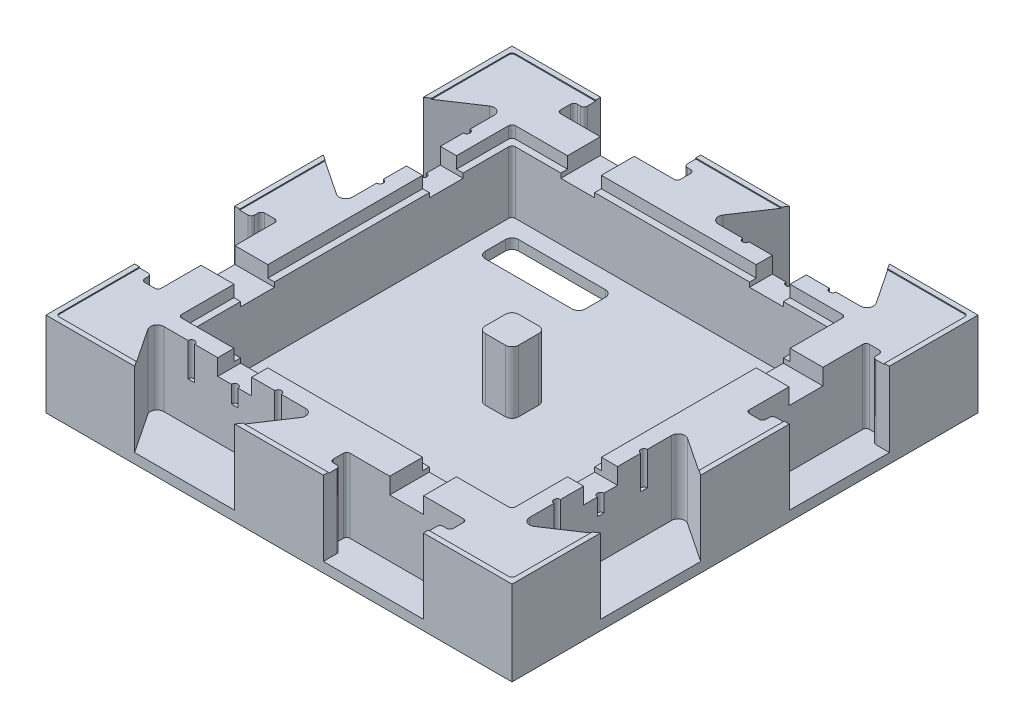
from build123d import *

# Parameters (mm, degrees)
SKETCH1_W           = 139.7
SKETCH1_H           = 139.7
BOSS_EXTRUDE1_DEPTH = 12.7
SKETCH2_W           = 136.7
SKETCH2_H           = 136.7
CUT_EXTRUDE1_DEPTH  = 0.3
CUT_EXTRUDE2_START  = -22.4
CUT_EXTRUDE2_DEPTH  = 125.396102867
CUT_EXTRUDE4_DEPTH  = 10
FILLET1_R           = 1
FILLET3_R           = 2
CIRPATTERN1_START   = -9.7
CIRPATTERN1_DEPTH   = 22.4
CIRPATTERN1_START_2 = 2.4
CIRPATTERN1_2_DEPTH = 10
SKETCH13_W          = 100
SKETCH13_H          = 100
CUT_EXTRUDE5_DEPTH  = 22.1
SKETCH14_W          = 100
SKETCH14_H          = 100
SKETCH14_W_2        = 96
SKETCH14_H_2        = 96
BOSS_EXTRUDE2_DEPTH = 18.6
SKETCH15_W          = 10
SKETCH15_H          = 10
PCB_SUPPORT_DEPTH   = 18.6
SKETCH16_W          = 30
SKETCH16_H          = 10
VENT_SUSSY_DEPTH    = 102.290695525
FILLET4_R           = 2
FILLET5_R           = 1
SKETCH18_W          = 10.16
SKETCH18_H          = 4.875
CUT_EXTRUDE6_DEPTH  = 20
CIRPATTERN4_COUNT   = 4


# Read off the part's stored shape, not the designer's step: CirPattern1
with BuildPart() as part:
    # Sketch1 → Boss-Extrude1 (new, symmetric)
    with BuildSketch(Plane(origin=(0, 0, 0), x_dir=(1, 0, 0), z_dir=(0, 1, 0))):
        Rectangle(SKETCH1_W, SKETCH1_H)
    extrude(amount=BOSS_EXTRUDE1_DEPTH, both=True)

    # Sketch2 → Cut-Extrude1 (cut)
    with BuildSketch(Plane(origin=(0, 12.7, 0), x_dir=(1, 0, 0), z_dir=(0, 1, 0))):
        Rectangle(SKETCH2_W, SKETCH2_H)
    extrude(amount=-CUT_EXTRUDE1_DEPTH, mode=Mode.SUBTRACT)

    # Sketch4 → Cut-Extrude2 (cut)
    with BuildSketch(Plane(origin=(0, 12.7, 0), x_dir=(1, 0, 0), z_dir=(0, 1, 0)).offset(CUT_EXTRUDE2_START)):
        Polygon((-43.283333333, -69.85), (-53.283333333, -54.85), (-3.283333333, -54.85), (-13.283333333, -69.85), align=None)
        Polygon((13.283333333, -69.85), (13.283333333, -64.85), (10.283333333, -64.85), (10.283333333, -59.85), (46.283333333, -59.85), (46.283333333, -64.85), (43.283333333, -64.85), (43.283333333, -69.85), align=None)
    extrude(amount=CUT_EXTRUDE2_DEPTH, mode=Mode.SUBTRACT)

    # Sketch6 → Cut-Extrude4 (cut)
    with BuildSketch(Plane(origin=(0, 12.4, 0), x_dir=(1, 0, 0), z_dir=(0, 1, 0))):
        with BuildLine():
            Line((-42.283333333, -54.85), (-40.283333333, -54.85))
            ThreePointArc((-40.283333333, -54.85), (-41.283333333, -53.85), (-42.283333333, -54.85))
        make_face()
        with BuildLine():
            Line((-29.283333333, -54.85), (-27.283333333, -54.85))
            ThreePointArc((-27.283333333, -54.85), (-28.283333333, -53.85), (-29.283333333, -54.85))
        make_face()
        with BuildLine():
            Line((-16.283333333, -54.85), (-14.283333333, -54.85))
            ThreePointArc((-14.283333333, -54.85), (-15.283333333, -53.85), (-16.283333333, -54.85))
        make_face()
    extrude(amount=-CUT_EXTRUDE4_DEPTH, mode=Mode.SUBTRACT)

    # Fillet1
    fillet1_edges = [part.edges().sort_by_distance(p)[0] for p in [
        (-68.35, 12.55, -68.35),
        (-68.35, 12.55, 68.35),
        (68.35, 12.55, 68.35),
        (68.35, 12.55, -68.35),
        (46.283333333, 1.35, 64.85),
        (46.283333333, 1.35, 59.85),
        (10.283333333, 1.35, 59.85),
        (10.283333333, 1.35, 64.85),
        (13.283333333, 1.35, 64.85),
        (43.283333333, 1.35, 64.85),
    ]]
    fillet(fillet1_edges, radius=FILLET1_R)

    # Fillet3
    fillet3_edges = [part.edges().sort_by_distance(p)[0] for p in [
        (-53.283333333, 1.35, 54.85),
        (-3.283333333, 1.35, 54.85),
    ]]
    fillet(fillet3_edges, radius=FILLET3_R)

    # CirPattern1 outline → CirPattern1 (cut)
    with BuildSketch(Plane(origin=(0, 0, 0), x_dir=(1, 0, 0), z_dir=(0, 1, 0)).offset(CIRPATTERN1_START)):
        with BuildLine():
            ThreePointArc((65.85, 43.283333333), (65.142893219, 43.576226552), (64.85, 44.283333333))
            Line((64.85, 44.283333333), (64.85, 45.283333333))
            ThreePointArc((64.85, 45.283333333), (64.557106781, 45.990440115), (63.85, 46.283333333))
            Line((63.85, 46.283333333), (60.85, 46.283333333))
            ThreePointArc((60.85, 46.283333333), (60.142893218, 45.990440115), (59.85, 45.283333333))
            Line((59.85, 45.283333333), (59.85, 11.283333333))
            ThreePointArc((59.85, 11.283333333), (60.142893219, 10.576226552), (60.85, 10.283333333))
            Line((60.85, 10.283333333), (63.85, 10.283333333))
            ThreePointArc((63.85, 10.283333333), (64.557106781, 10.576226552), (64.85, 11.283333333))
            Line((64.85, 11.283333333), (64.85, 12.283333333))
            ThreePointArc((64.85, 12.283333333), (65.142893218, 12.990440114), (65.85, 13.283333333))
            Line((65.85, 13.283333333), (69.85, 13.283333333))
            Line((69.85, 13.283333333), (69.85, 43.283333333))
            Line((69.85, 43.283333333), (65.85, 43.283333333))
        make_face()
        with BuildLine():
            Line((-69.85, 43.283333333), (-69.85, 13.283333333))
            Line((-69.85, 13.283333333), (-57.959400392, 5.356266928))
            ThreePointArc((-57.959400392, 5.356266928), (-55.906284149, 5.257018319), (-54.85, 7.020367517))
            Line((-54.85, 7.020367517), (-54.85, 49.54629915))
            ThreePointArc((-54.85, 49.54629915), (-55.906284149, 51.309648347), (-57.959400392, 51.210399738))
            Line((-57.959400392, 51.210399738), (-69.85, 43.283333333))
        make_face()
        with BuildLine():
            Line((43.283333333, 69.85), (13.283333333, 69.85))
            Line((13.283333333, 69.85), (5.356266928, 57.959400392))
            ThreePointArc((5.356266928, 57.959400392), (5.257018319, 55.906284149), (7.020367517, 54.85))
            Line((7.020367517, 54.85), (49.54629915, 54.85))
            ThreePointArc((49.54629915, 54.85), (51.309648347, 55.906284149), (51.210399738, 57.959400392))
            Line((51.210399738, 57.959400392), (43.283333333, 69.85))
        make_face()
        with BuildLine():
            Line((57.959400392, -51.210399738), (69.85, -43.283333333))
            Line((69.85, -43.283333333), (69.85, -13.283333333))
            Line((69.85, -13.283333333), (57.959400392, -5.356266928))
            ThreePointArc((57.959400392, -5.356266928), (55.906284149, -5.257018319), (54.85, -7.020367517))
            Line((54.85, -7.020367517), (54.85, -49.54629915))
            ThreePointArc((54.85, -49.54629915), (55.906284149, -51.309648347), (57.959400392, -51.210399738))
        make_face()
        with BuildLine():
            Line((-13.283333333, 69.85), (-43.283333333, 69.85))
            Line((-43.283333333, 69.85), (-43.283333333, 65.85))
            ThreePointArc((-43.283333333, 65.85), (-43.576226552, 65.142893219), (-44.283333333, 64.85))
            Line((-44.283333333, 64.85), (-45.283333333, 64.85))
            ThreePointArc((-45.283333333, 64.85), (-45.990440115, 64.557106781), (-46.283333333, 63.85))
            Line((-46.283333333, 63.85), (-46.283333333, 60.85))
            ThreePointArc((-46.283333333, 60.85), (-45.990440115, 60.142893218), (-45.283333333, 59.85))
            Line((-45.283333333, 59.85), (-11.283333333, 59.85))
            ThreePointArc((-11.283333333, 59.85), (-10.576226552, 60.142893219), (-10.283333333, 60.85))
            Line((-10.283333333, 60.85), (-10.283333333, 63.85))
            ThreePointArc((-10.283333333, 63.85), (-10.576226552, 64.557106781), (-11.283333333, 64.85))
            Line((-11.283333333, 64.85), (-12.283333333, 64.85))
            ThreePointArc((-12.283333333, 64.85), (-12.990440114, 65.142893218), (-13.283333333, 65.85))
            Line((-13.283333333, 65.85), (-13.283333333, 69.85))
        make_face()
        with BuildLine():
            Line((-69.85, -13.283333333), (-69.85, -43.283333333))
            Line((-69.85, -43.283333333), (-65.85, -43.283333333))
            ThreePointArc((-65.85, -43.283333333), (-65.142893219, -43.576226552), (-64.85, -44.283333333))
            Line((-64.85, -44.283333333), (-64.85, -45.283333333))
            ThreePointArc((-64.85, -45.283333333), (-64.557106781, -45.990440115), (-63.85, -46.283333333))
            Line((-63.85, -46.283333333), (-60.85, -46.283333333))
            ThreePointArc((-60.85, -46.283333333), (-60.142893218, -45.990440115), (-59.85, -45.283333333))
            Line((-59.85, -45.283333333), (-59.85, -11.283333333))
            ThreePointArc((-59.85, -11.283333333), (-60.142893219, -10.576226552), (-60.85, -10.283333333))
            Line((-60.85, -10.283333333), (-63.85, -10.283333333))
            ThreePointArc((-63.85, -10.283333333), (-64.557106781, -10.576226552), (-64.85, -11.283333333))
            Line((-64.85, -11.283333333), (-64.85, -12.283333333))
            ThreePointArc((-64.85, -12.283333333), (-65.142893218, -12.990440114), (-65.85, -13.283333333))
            Line((-65.85, -13.283333333), (-69.85, -13.283333333))
        make_face()
    extrude(amount=CIRPATTERN1_DEPTH, mode=Mode.SUBTRACT)

    # CirPattern1 2 outline → CirPattern1 2 (cut)
    with BuildSketch(Plane(origin=(0, 0, 0), x_dir=(1, 0, 0), z_dir=(0, 1, 0)).offset(CIRPATTERN1_START_2)):
        with BuildLine():
            Line((54.85, -16.283333333), (54.85, -14.283333333))
            ThreePointArc((54.85, -14.283333333), (53.85, -15.283333333), (54.85, -16.283333333))
        make_face()
        with BuildLine():
            ThreePointArc((54.85, -40.283333333), (53.85, -41.283333333), (54.85, -42.283333333))
            Line((54.85, -42.283333333), (54.85, -40.283333333))
        make_face()
        with BuildLine():
            ThreePointArc((40.283333333, 54.85), (41.283333333, 53.85), (42.283333333, 54.85))
            Line((42.283333333, 54.85), (40.283333333, 54.85))
        make_face()
        with BuildLine():
            Line((54.85, -29.283333333), (54.85, -27.283333333))
            ThreePointArc((54.85, -27.283333333), (53.85, -28.283333333), (54.85, -29.283333333))
        make_face()
        with BuildLine():
            Line((16.283333333, 54.85), (14.283333333, 54.85))
            ThreePointArc((14.283333333, 54.85), (15.283333333, 53.85), (16.283333333, 54.85))
        make_face()
        with BuildLine():
            ThreePointArc((27.283333333, 54.85), (28.283333333, 53.85), (29.283333333, 54.85))
            Line((29.283333333, 54.85), (27.283333333, 54.85))
        make_face()
        with BuildLine():
            ThreePointArc((-54.85, 40.283333333), (-53.85, 41.283333333), (-54.85, 42.283333333))
            Line((-54.85, 42.283333333), (-54.85, 40.283333333))
        make_face()
        with BuildLine():
            Line((-54.85, 16.283333333), (-54.85, 14.283333333))
            ThreePointArc((-54.85, 14.283333333), (-53.85, 15.283333333), (-54.85, 16.283333333))
        make_face()
        with BuildLine():
            ThreePointArc((-54.85, 27.283333333), (-53.85, 28.283333333), (-54.85, 29.283333333))
            Line((-54.85, 29.283333333), (-54.85, 27.283333333))
        make_face()
    extrude(amount=CIRPATTERN1_2_DEPTH, mode=Mode.SUBTRACT)

    # Sketch13 → Cut-Extrude5 (cut)
    with BuildSketch(Plane(origin=(0, 12.4, 0), x_dir=(1, 0, 0), z_dir=(0, 1, 0))):
        Rectangle(SKETCH13_W, SKETCH13_H)
    extrude(amount=-CUT_EXTRUDE5_DEPTH, mode=Mode.SUBTRACT)

    # Sketch14 → Boss-Extrude2 (add)
    with BuildSketch(Plane(origin=(0, -9.7, 0), x_dir=(1, 0, 0), z_dir=(0, 1, 0))):
        Rectangle(SKETCH14_W, SKETCH14_H)
        Rectangle(SKETCH14_W_2, SKETCH14_H_2, mode=Mode.SUBTRACT)
    extrude(amount=BOSS_EXTRUDE2_DEPTH)

    # Sketch15 → PCB_Support (add)
    with BuildSketch(Plane(origin=(0, -9.7, 0), x_dir=(1, 0, 0), z_dir=(0, 1, 0))):
        Rectangle(SKETCH15_W, SKETCH15_H)
    extrude(amount=PCB_SUPPORT_DEPTH)

    # Sketch16 → Vent_Sussy (cut, through all)
    with BuildSketch(Plane(origin=(0, -9.7, 0), x_dir=(1, 0, 0), z_dir=(0, 1, 0))):
        with Locations((-28, 38)):
            Rectangle(SKETCH16_W, SKETCH16_H)
    extrude(amount=-VENT_SUSSY_DEPTH, mode=Mode.SUBTRACT)

    # Fillet4
    fillet4_edges = [part.edges().sort_by_distance(p)[0] for p in [
        (-5, -0.4, 5),
        (-5, -0.4, -5),
        (5, -0.4, -5),
        (5, -0.4, 5),
        (-43, -11.2, -33),
        (-43, -11.2, -43),
        (-13, -11.2, -43),
        (-13, -11.2, -33),
    ]]
    fillet(fillet4_edges, radius=FILLET4_R)

    # Fillet5
    fillet5_edges = [part.edges().sort_by_distance(p)[0] for p in [
        (50, 10.65, 50),
        (50, 10.65, -50),
        (-50, 10.65, 50),
        (-50, 10.65, -50),
        (48, -0.4, -48),
        (-48, -0.4, -48),
        (-48, -0.4, 48),
        (48, -0.4, 48),
    ]]
    fillet(fillet5_edges, radius=FILLET5_R)

    # Sketch18 → Cut-Extrude6 (cut)
    with BuildSketch(Plane.XY.offset(59.85)):
        with Locations((28.283333333, 9.9625)):
            Rectangle(SKETCH18_W, SKETCH18_H)
        with Locations((-28.283333333, 9.9625)):
            Rectangle(SKETCH18_W, SKETCH18_H)
    cut_extrude6 = extrude(amount=-CUT_EXTRUDE6_DEPTH, mode=Mode.SUBTRACT)

    # CirPattern4: Cut-Extrude6 ×4 about axis
    cirpattern4_axis = Axis((0, 0, 0), (0, 1, 0))
    for i in range(1, CIRPATTERN4_COUNT):
        add(cut_extrude6.rotate(cirpattern4_axis, i * 360 / CIRPATTERN4_COUNT), mode=Mode.SUBTRACT)


solid = part.part
